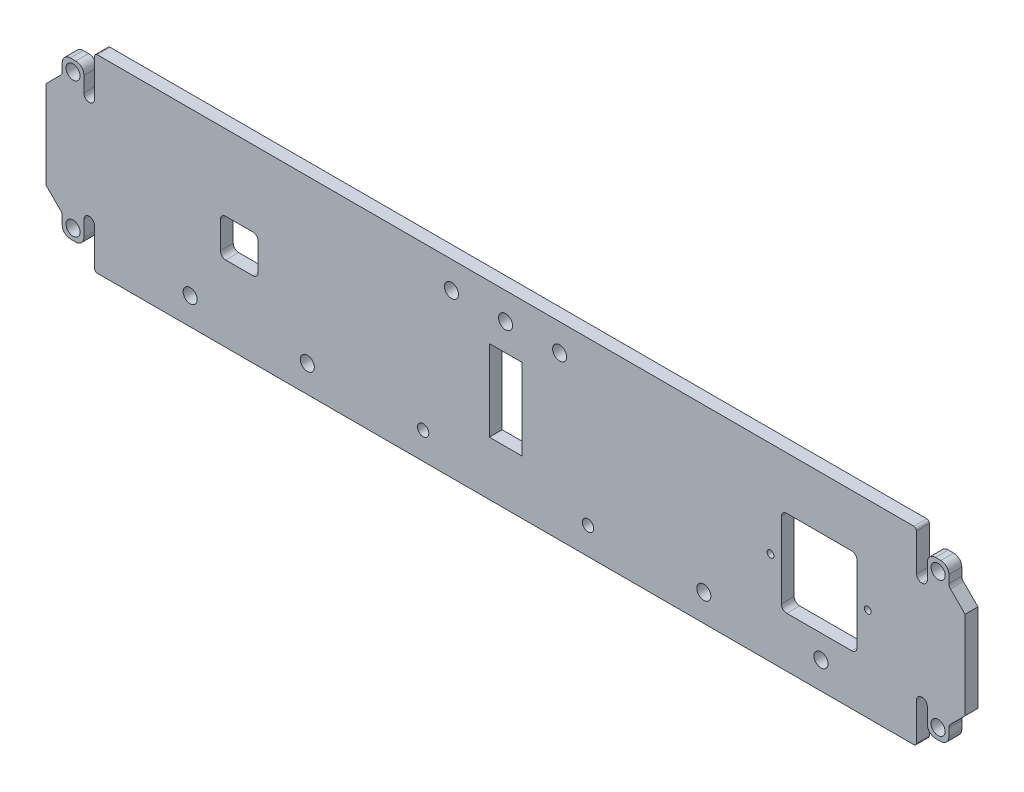
from build123d import *

# Parameters (mm, degrees)
BASE_FLANGE1_DEPTH         = 4.7625
CUT_EXTRUDE1_DEPTH         = 348.163767416
CUT_EXTRUDE2_DEPTH         = 348.163767416
SKETCH20_W                 = 12
SKETCH20_H                 = 30
CUT_EXTRUDE5_DEPTH         = 348.163767416
F_5_2_5_2_DIAMETER_HOLE1_D = 5.2
F_4_2_4_2_DIAMETER_HOLE1_D = 4.2
F_2_5_2_5_DIAMETER_HOLE1_D = 2.5


# Sheet-metal steps are written as plain solids
with BuildPart() as part:
    # Sketch11 → Base-Flange1 (new body)
    with BuildSketch(Plane(origin=(0, 0, 0), x_dir=(-1, 0, 0), z_dir=(0, 0, -1))):
        with BuildLine():
            Line((-17.976164198, 1), (-17.976164198, 14.75465548))
            ThreePointArc((-17.976164198, 14.75465548), (-15.991789198, 16.73903048), (-14.007414198, 14.75465548))
            Line((-14.007414198, 14.75465548), (-14.007414198, 9))
            ThreePointArc((-14.007414198, 9), (-13.128734542, 6.878679656), (-11.007414198, 6))
            Line((-11.007414198, 6), (-9, 6))
            ThreePointArc((-9, 6), (-6.878679657, 6.878679656), (-6, 9))
            Line((-6, 9), (-6, 11.917075442))
            ThreePointArc((-6, 11.917075442), (-5.848948447, 12.676462879), (-5.418790019, 13.320240461))
            Line((-5.418790019, 13.320240461), (0, 18.73903048))
            Line((0, 18.73903048), (0, 51.26096952))
            Line((0, 51.26096952), (-5.418790019, 56.679759539))
            ThreePointArc((-5.418790019, 56.679759539), (-5.848948447, 57.323537121), (-6, 58.082924558))
            Line((-6, 58.082924558), (-6, 61))
            ThreePointArc((-6, 61), (-6.878679657, 63.121320343), (-9, 64))
            Line((-9, 64), (-11.007414198, 64))
            ThreePointArc((-11.007414198, 64), (-13.128734542, 63.121320343), (-14.007414198, 61))
            Line((-14.007414198, 61), (-14.007414198, 55.24534452))
            ThreePointArc((-14.007414198, 55.24534452), (-15.991789198, 53.26096952), (-17.976164198, 55.24534452))
            Line((-17.976164198, 55.24534452), (-17.976164198, 69))
            ThreePointArc((-17.976164198, 69), (-18.269057417, 69.707106781), (-18.976164198, 70))
            Line((-18.976164198, 70), (-321.023835802, 70))
            ThreePointArc((-321.023835802, 70), (-321.730942583, 69.707106781), (-322.023835802, 69))
            Line((-322.023835802, 69), (-322.023835802, 55.24534452))
            ThreePointArc((-322.023835802, 55.24534452), (-322.605045783, 53.842179501), (-324.008210802, 53.26096952))
            Line((-324.008210802, 53.26096952), (-324.039460804, 53.26096952))
            ThreePointArc((-324.039460804, 53.26096952), (-325.442625823, 53.842179501), (-326.023835804, 55.24534452))
            Line((-326.023835804, 55.24534452), (-326.023835804, 61))
            ThreePointArc((-326.023835804, 61), (-326.90251546, 63.121320343), (-329.023835804, 64))
            Line((-329.023835804, 64), (-331, 64))
            ThreePointArc((-331, 64), (-333.121320344, 63.121320343), (-334, 61))
            Line((-334, 61), (-334, 58.082924558))
            ThreePointArc((-334, 58.082924558), (-334.151051553, 57.323537121), (-334.581209981, 56.679759539))
            Line((-334.581209981, 56.679759539), (-340, 51.26096952))
            Line((-340, 51.26096952), (-340, 18.73903048))
            Line((-340, 18.73903048), (-334.581209981, 13.320240461))
            ThreePointArc((-334.581209981, 13.320240461), (-334.151051553, 12.676462879), (-334, 11.917075442))
            Line((-334, 11.917075442), (-334, 9))
            ThreePointArc((-334, 9), (-333.121320344, 6.878679656), (-331, 6))
            Line((-331, 6), (-329.023835804, 6))
            ThreePointArc((-329.023835804, 6), (-326.90251546, 6.878679656), (-326.023835804, 9))
            Line((-326.023835804, 9), (-326.023835804, 14.75465548))
            ThreePointArc((-326.023835804, 14.75465548), (-325.442625823, 16.157820499), (-324.039460804, 16.73903048))
            Line((-324.039460804, 16.73903048), (-324.008210802, 16.73903048))
            ThreePointArc((-324.008210802, 16.73903048), (-322.605045783, 16.157820499), (-322.023835802, 14.75465548))
            Line((-322.023835802, 14.75465548), (-322.023835802, 1))
            ThreePointArc((-322.023835802, 1), (-321.730942583, 0.292893219), (-321.023835802, 0))
            Line((-321.023835802, 0), (-18.976164198, 0))
            ThreePointArc((-18.976164198, 0), (-18.269057417, 0.292893219), (-17.976164198, 1))
        make_face()
    extrude(amount=-BASE_FLANGE1_DEPTH)

    # Sketch16 → Cut-Extrude1 (cut, through all)
    with BuildSketch(Plane(origin=(0, 0, 0), x_dir=(-1, 0, 0), z_dir=(0, 0, -1))):
        with BuildLine():
            Line((-274, 50.597720146), (-298, 50.597720146))
            ThreePointArc((-298, 50.597720146), (-299.414213562, 50.011933709), (-300, 48.597720146))
            Line((-300, 48.597720146), (-300, 20.597720146))
            ThreePointArc((-300, 20.597720146), (-299.414213562, 19.183506584), (-298, 18.597720146))
            Line((-298, 18.597720146), (-274, 18.597720146))
            ThreePointArc((-274, 18.597720146), (-272.585786438, 19.183506584), (-272, 20.597720146))
            Line((-272, 20.597720146), (-272, 48.597720146))
            ThreePointArc((-272, 48.597720146), (-272.585786438, 50.011933709), (-274, 50.597720146))
        make_face()
    extrude(amount=-CUT_EXTRUDE1_DEPTH, mode=Mode.SUBTRACT)

    # Sketch17 → Cut-Extrude2 (cut, through all)
    with BuildSketch(Plane(origin=(0, 0, 0), x_dir=(-1, 0, 0), z_dir=(0, 0, -1))):
        with BuildLine():
            Line((-64.5, 30), (-64.5, 40))
            ThreePointArc((-64.5, 40), (-65.085786438, 41.414213562), (-66.5, 42))
            Line((-66.5, 42), (-76.5, 42))
            ThreePointArc((-76.5, 42), (-77.914213563, 41.414213562), (-78.5, 40))
            Line((-78.5, 40), (-78.5, 30))
            ThreePointArc((-78.5, 30), (-77.914213563, 28.585786438), (-76.5, 28))
            Line((-76.5, 28), (-66.5, 28))
            ThreePointArc((-66.5, 28), (-65.085786438, 28.585786438), (-64.5, 30))
        make_face()
    extrude(amount=-CUT_EXTRUDE2_DEPTH, mode=Mode.SUBTRACT)

    # Sketch20 → Cut-Extrude5 (cut, through all)
    with BuildSketch(Plane.XY.offset(4.7625)):
        with Locations((170, 35)):
            Rectangle(SKETCH20_W, SKETCH20_H)
    extrude(amount=-CUT_EXTRUDE5_DEPTH, mode=Mode.SUBTRACT)

    # Ø5.2 (5.2) Diameter Hole1 (through all)
    with Locations(Plane.XY.offset(4.7625)):
        with Locations((170, 60), (330, 60), (10, 10), (10, 60), (330, 10), (150, 60), (190, 60), (53.333333333, 10), (96.666666667, 10), (243.333333333, 10), (286.666666667, 10)):
            Hole(F_5_2_5_2_DIAMETER_HOLE1_D / 2)

    # Ø4.2 (4.2) Diameter Hole1 (through all)
    with Locations(Plane(origin=(0, 0, 0), x_dir=(-1, 0, 0), z_dir=(0, 0, -1))):
        with Locations((-200.5, 10), (-139.5, 10)):
            Hole(F_4_2_4_2_DIAMETER_HOLE1_D / 2)

    # Ø2.5 (2.5) Diameter Hole1 (through all)
    with Locations(Plane(origin=(0, 0, 0), x_dir=(-1, 0, 0), z_dir=(0, 0, -1))):
        with Locations((-304, 34.597720146), (-268, 34.597720146)):
            Hole(F_2_5_2_5_DIAMETER_HOLE1_D / 2)


solid = part.part
